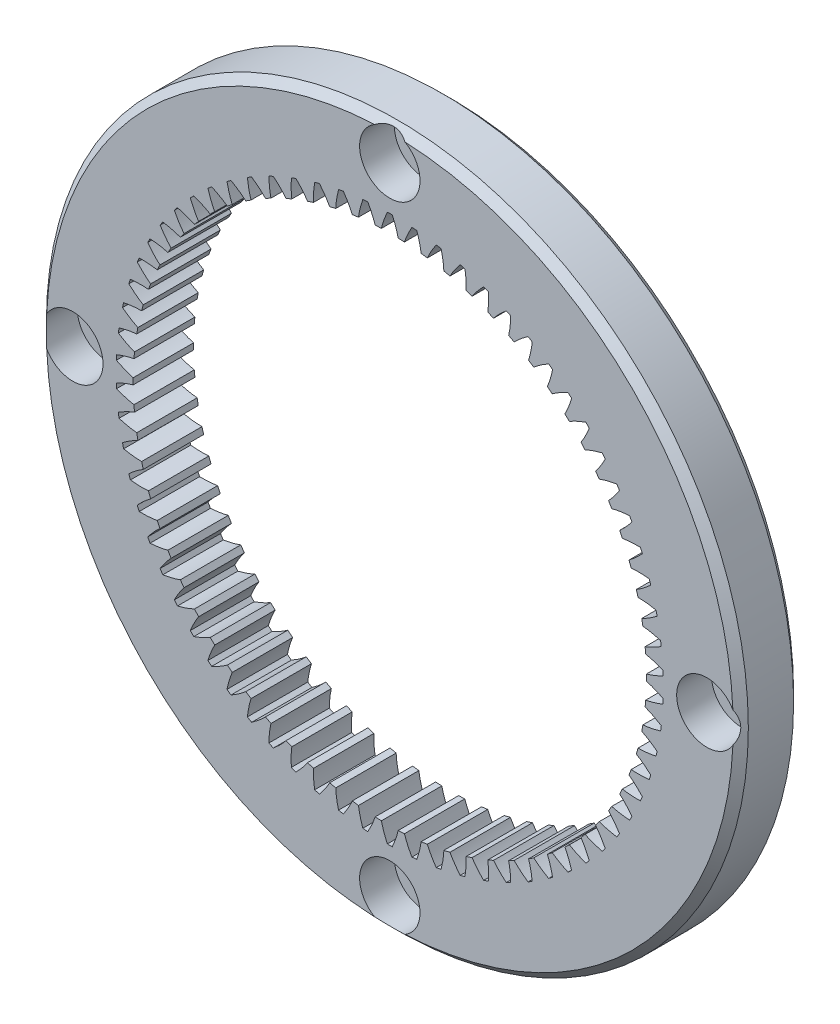
from build123d import *

# Parameters (mm, degrees)
GEAR_BASESKETCH_R                = 23.25
GEAR_BASESKETCH_R_2              = 17
F_0_5_MODULE_35_0000MM_P_D_DEPTH = 2
TOOTH_CUT_START                  = -2
TOOTH_CUT_DIN_867_DEPTH          = 4
PATTERN_CIRCULAR_1_COUNT         = 70
HOLE_WIZARD_2_D                  = 2.4
HOLE_WIZARD_2_CBORE_D            = 4
HOLE_WIZARD_2_CBORE_DEPTH        = 2.3
PATTERN_CIRCULAR_2_COUNT         = 4
CHAMFER_1_SIZE                   = 0.5


with BuildPart() as part:
    # Gear-BaseSketch → 0.5 Module, 35.0000mm P.D. (new, symmetric)
    with BuildSketch(Plane.XY):
        Circle(GEAR_BASESKETCH_R)
        Circle(GEAR_BASESKETCH_R_2, mode=Mode.SUBTRACT)
    extrude(amount=F_0_5_MODULE_35_0000MM_P_D_DEPTH, both=True)

    # Tooth-Sketch; Backlash: 0.0400mm → Tooth-Cut, DIN-867 (cut)
    with BuildSketch(Plane.XY.offset(TOOTH_CUT_START)):
        with BuildLine():
            Line((0, 0), (0.556184022, 16.990899309))
            add(Edge.make_bspline(
                [(0.556184022, 16.990899309), (0.551720652, 17.010171809), (0.542570965, 17.049679481), (0.527475233, 17.110137547), (0.510877157, 17.173269292), (0.49262278, 17.239024892), (0.472661627, 17.307376439), (0.450914324, 17.378287811), (0.427310547, 17.45172332), (0.401778261, 17.527645271), (0.374246653, 17.606014597), (0.344645978, 17.686790986), (0.312905107, 17.769931713), (0.278962185, 17.855396486), (0.242722723, 17.943128467), (0.204223789, 18.033128606), (0.177140306, 18.093584588), (0.163396568, 18.124263476)],
                knots=[0, 0, 0, 0, 0.049395374, 0.101258075, 0.155588104, 0.21238546, 0.271650144, 0.333382155, 0.397581494, 0.464248161, 0.533382155, 0.604983477, 0.679052127, 0.755588104, 0.834591408, 0.91606204, 1, 1, 1, 1], degree=3))
            ThreePointArc((0.163396568, 18.124263476), (0, 18.125), (-0.163396568, 18.124263476))
            add(Edge.make_bspline(
                [(-0.556184022, 16.990899309), (-0.551720652, 17.010171809), (-0.542570965, 17.049679481), (-0.527475233, 17.110137547), (-0.510877157, 17.173269292), (-0.49262278, 17.239024892), (-0.472661627, 17.307376439), (-0.450914324, 17.378287811), (-0.427310547, 17.45172332), (-0.401778261, 17.527645271), (-0.374246653, 17.606014597), (-0.344645978, 17.686790986), (-0.312905107, 17.769931713), (-0.278962185, 17.855396486), (-0.242722723, 17.943128467), (-0.204223789, 18.033128606), (-0.177140306, 18.093584588), (-0.163396568, 18.124263476)],
                knots=[0, 0, 0, 0, 0.049395374, 0.101258075, 0.155588104, 0.21238546, 0.271650144, 0.333382155, 0.397581494, 0.464248161, 0.533382155, 0.604983477, 0.679052127, 0.755588104, 0.834591408, 0.91606204, 1, 1, 1, 1], degree=3))
            Line((-0.556184022, 16.990899309), (0, 0))
        make_face()
    tooth_cut_din_867 = extrude(amount=TOOTH_CUT_DIN_867_DEPTH, mode=Mode.SUBTRACT)

    # 阵列(圆周)1: Tooth-Cut, DIN-867 ×70 about axis
    pattern_circular_1_axis = Axis((0, 0, 2), (0, 0, -1))
    for i in range(1, PATTERN_CIRCULAR_1_COUNT):
        add(tooth_cut_din_867.rotate(pattern_circular_1_axis, i * 360 / PATTERN_CIRCULAR_1_COUNT), mode=Mode.SUBTRACT)

    # 打孔尺寸根据内六角圆柱头螺钉的类型2 (through all)
    with Locations(Plane(origin=(0, 21, 2), x_dir=(1, 0, 0), z_dir=(0, 0, 1))):
        with Locations((0, 0)):
            hole_wizard_2 = CounterBoreHole(HOLE_WIZARD_2_D / 2, HOLE_WIZARD_2_CBORE_D / 2, HOLE_WIZARD_2_CBORE_DEPTH)

    # 阵列(圆周)2: 打孔尺寸根据内六角圆柱头螺钉的类型2 ×4 about axis
    pattern_circular_2_axis = Axis((0, 0, 0), (0, 0, 1))
    for i in range(1, PATTERN_CIRCULAR_2_COUNT):
        add(hole_wizard_2.rotate(pattern_circular_2_axis, i * 360 / PATTERN_CIRCULAR_2_COUNT), mode=Mode.SUBTRACT)

    # 倒角1
    # the kernel refuses this chamfer: 0.5 mm, written as the material it takes off along each edge
    with BuildSketch(Plane(origin=(0, 0, -2), x_dir=(1, 0, 0), z_dir=(0, -1, 0))) as chamfer_1_piece_1:
        Polygon((23.25, CHAMFER_1_SIZE), (23.25 - CHAMFER_1_SIZE, 0), (23.25, 0), align=None)
    revolve(axis=Axis((0, 0, -2), (0, 0, 1)), mode=Mode.SUBTRACT)
    with BuildSketch(Plane(origin=(0, 0, 2), x_dir=(1, 0, 0), z_dir=(0, -1, 0))) as chamfer_1_piece_2:
        Polygon((23.25, -CHAMFER_1_SIZE), (23.25 - CHAMFER_1_SIZE, 0), (23.25, 0), align=None)
    revolve(axis=Axis((0, 0, 2), (0, 0, 1)), mode=Mode.SUBTRACT)


solid = part.part
